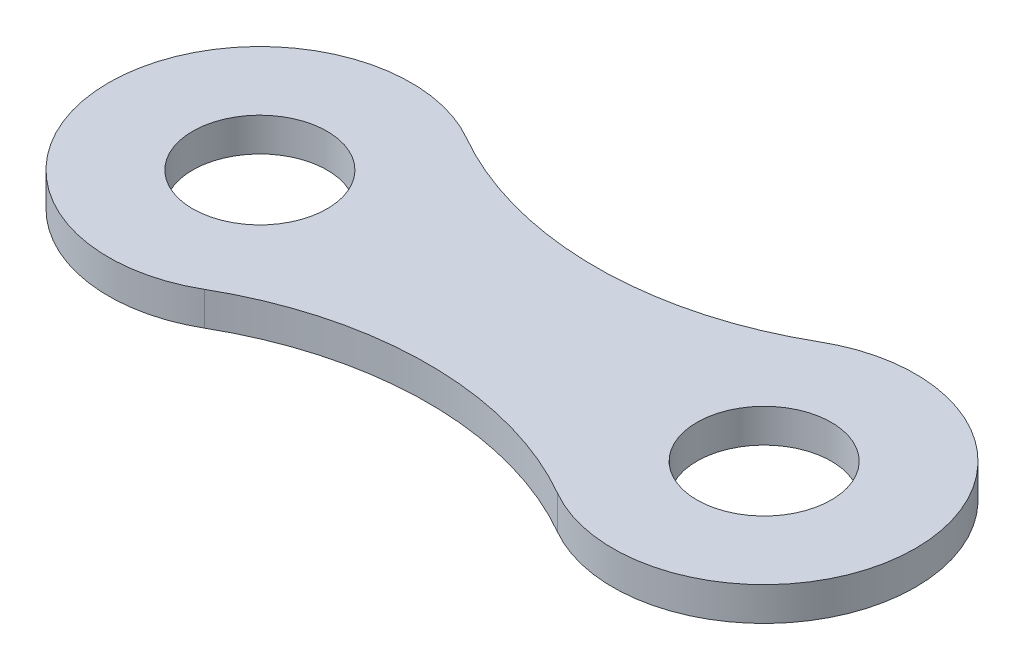
from build123d import *

# Parameters (mm, degrees)
SKIZZE2_R          = 2
BASIS_BLECH1_DEPTH = 1


# Sheet-metal steps are written as plain solids
with BuildPart() as part:
    # Skizze2 → Basis-Blech1 (new body)
    with BuildSketch(Plane(origin=(0, 0, 0), x_dir=(1, 0, 0), z_dir=(0, 1, 0))):
        with BuildLine():
            ThreePointArc((-5.254458339, 3.899684942), (0, 2.494976886), (5.254458339, 3.899684942))
            ThreePointArc((5.254458339, 3.899684942), (12, 0), (5.254458339, -3.899684942))
            ThreePointArc((5.254458339, -3.899684942), (0, -2.494976886), (-5.254458339, -3.899684942))
            ThreePointArc((-5.254458339, -3.899684942), (-12, 0), (-5.254458339, 3.899684942))
        make_face()
        with Locations(Location((-7.5, 0, 0), (0, 0, 270))):
            Circle(SKIZZE2_R, mode=Mode.SUBTRACT)
        with Locations(Location((7.5, 0, 0), (0, 0, 270))):
            Circle(SKIZZE2_R, mode=Mode.SUBTRACT)
    extrude(amount=-BASIS_BLECH1_DEPTH)


solid = part.part
